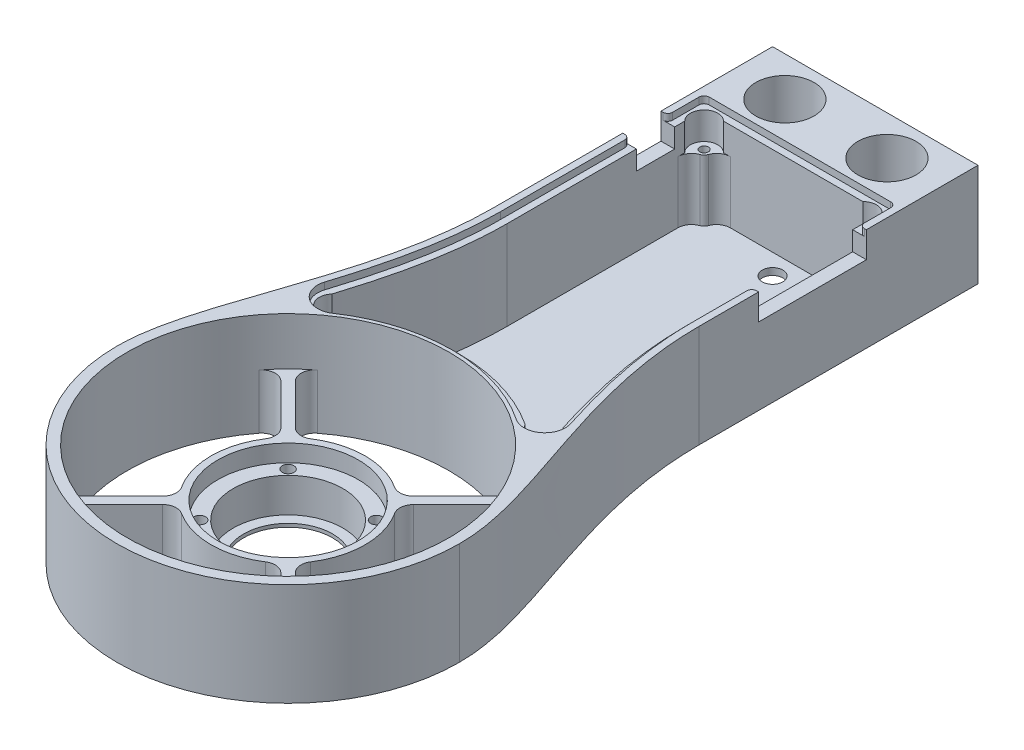
from build123d import *
from build123d.topology import SkipClean

# Parameters (mm, degrees)
EXTRUDE_1_DEPTH            = 30
CUT_EXTRUDE_1_DEPTH        = 209.327033807
SKETCH_3_R                 = 22.5
SKETCH_3_R_2               = 13
EXTRUDE_2_DEPTH            = 16
SKETCH_4_R                 = 20.5
CUT_EXTRUDE_2_DEPTH        = 5
SKETCH_5_R                 = 16
CUT_EXTRUDE_3_DEPTH        = 10
SKETCH_7_W                 = 1.7
SKETCH_7_H                 = 11
HOLE_WIZARD_M31_AT_2_COUNT = 2
HOLE_WIZARD_M31_AT_2_PITCH = 25.809397513
HOLE_WIZARD_M31_AT_3_COUNT = 2
HOLE_WIZARD_M31_AT_3_PITCH = 36.5
HOLE_WIZARD_M31_AT_4_COUNT = 2
HOLE_WIZARD_M31_AT_4_PITCH = 25.809397513
EXTRUDE_3_DEPTH            = 16
EXTRUDE_4_DEPTH            = 16
FILLET_1_R                 = 4
FILLET_2_R                 = 4
EXTRUDE_5_DEPTH            = 30
EXTRUDE_6_DEPTH            = 14
EXTRUDE_START              = -30
EXTRUDE_7_DEPTH            = 30
CUT_EXTRUDE_4_DEPTH        = 209.327033807
EXTRUDE_9_DEPTH            = 30
EXTRUDE_10_DEPTH           = 2
SKETCH_19_R                = 2.5
EXTRUDE_11_DEPTH           = 6
M3X0_51_D                  = 2.5
M3X0_51_DEPTH              = 5
M3X0_51_TIP                = 0.751075774
EXTRUDE_12_DEPTH           = 2
CUT_EXTRUDE_5_DEPTH        = 209.327033807
SKETCH_24_W                = 52
SKETCH_24_H                = 1.5
EXTRUDE_14_DEPTH           = 28
EXTRUDE_15_DEPTH           = 20
CUT_EXTRUDE_6_DEPTH        = 2
CUT_EXTRUDE_7_DEPTH        = 4
SKETCH_34_R                = 3
CUT_EXTRUDE_8_DEPTH        = 209.048439106
CUT_EXTRUDE_9_DEPTH        = 6
SKETCH_36_R                = 3
EXTRUDE_17_DEPTH           = 18
M3X0_52_D                  = 2.5
M3X0_52_DEPTH              = 8.5
M3X0_52_TIP                = 0.751075774
FILLET_4_R                 = 4
FILLET_START               = 1
FILLET_5_DEPTH             = 19
FILLET_6_R                 = 4
FILLET_7_DEPTH             = 19
FILLET_8_R                 = 4
SKETCH_39_R                = 3
CUT_EXTRUDE_10_DEPTH       = 209.048439106
CUT_EXTRUDE_12_DEPTH       = 2
FILLET_9_R                 = 1.5
CUT_EXTRUDE_13_REACH       = 210.327
SKETCH_44_W                = 11.16
SKETCH_44_H                = 7.6
FILLET_10_R                = 1.4
SKETCH_46_R                = 4
CUT_EXTRUDE_14_DEPTH       = 8
EXTRUDE_18_DEPTH           = 30


with BuildPart() as part:
    # Эскиз1 → Бобышка-Вытянуть1 (new body)
    with BuildSketch(Plane(origin=(0, 0, 0), x_dir=(1, 0, 0), z_dir=(0, 1, 0))):
        with BuildLine():
            Line((0, 0), (8.1, 0))
            ThreePointArc((8.1, 0), (15.1, -7), (22.1, 0))
            Line((22.1, 0), (37.9, 0))
            ThreePointArc((37.9, 0), (44.9, -7), (51.9, 0))
            Line((51.9, 0), (60, 0))
            Line((60, 0), (60, -50))
            add(Edge.make_bspline(
                [(60, -50), (60, -86.116353651), (80.160728995, -116.642608399), (80, -140)],
                knots=[0, 0, 0, 0, 1, 1, 1, 1], degree=3))
            ThreePointArc((80, -140), (30, -190), (-20, -140))
            add(Edge.make_bspline(
                [(0, -50), (0, -86.116353651), (-20.160728995, -116.642608399), (-20, -140)],
                knots=[0, 0, 0, 0, 1, 1, 1, 1], degree=3))
            Line((0, -50), (0, 0))
        make_face()
    extrude(amount=EXTRUDE_1_DEPTH)

    # Эскиз2 → Вырез-Вытянуть1 (cut, through all)
    with BuildSketch(Plane.XZ):
        with BuildLine():
            Line((3, 50), (3, 3))
            Line((3, 3), (5.560607986, 3))
            ThreePointArc((5.560607986, 3), (15.1, 10), (24.639392014, 3))
            Line((24.639392014, 3), (35.360607986, 3))
            ThreePointArc((35.360607986, 3), (44.9, 10), (54.439392014, 3))
            Line((54.439392014, 3), (57, 3))
            Line((57, 3), (57, 50))
            add(Edge.make_bspline(
                [(57, 50), (57, 51.157619484), (57.040607312, 53.481441414), (57.273709046, 58.05633088), (57.830062064, 63.685752057), (58.858254923, 70.27885976), (60.625878255, 78.854729592), (63.422502325, 89.162823296), (67.223452697, 100.856761308), (70.982787265, 111.851189123), (73.680425705, 120.399524986), (75.344386592, 126.838965256), (76.290218779, 131.460253347), (76.783421903, 135.123225854), (76.977758529, 137.948366969), (77.004903817, 139.304391304), (76.999998858, 139.989637546)],
                knots=[0, 0, 0, 0, 0.031254955, 0.062509911, 0.125019821, 0.187529732, 0.250039643, 0.375059464, 0.500079285, 0.625099107, 0.750118928, 0.812628839, 0.875138749, 0.93764866, 0.968903615, 1.000158571, 1.000158571, 1.000158571, 1.000158571], degree=3))
            ThreePointArc((76.999998858, 139.989637546), (30, 187), (-16.999998858, 139.989637546))
            add(Edge.make_bspline(
                [(-16.999998858, 139.989637546), (-17.004903817, 139.304391304), (-16.977758529, 137.948366969), (-16.783421903, 135.123225854), (-16.29021878, 131.460253347), (-15.344386592, 126.838965256), (-13.680425705, 120.399524986), (-10.982787266, 111.851189124), (-7.223452697, 100.856761308), (-3.422502325, 89.162823296), (-0.625878255, 78.854729592), (1.141745077, 70.27885976), (2.169937936, 63.685752057), (2.726290954, 58.05633088), (2.959392688, 53.481441414), (3, 51.157619484), (3, 50)],
                knots=[-0.000158571, -0.000158571, -0.000158571, -0.000158571, 0.031096385, 0.06235134, 0.124861251, 0.187371161, 0.249881072, 0.374900893, 0.499920715, 0.624940536, 0.749960357, 0.812470268, 0.874980179, 0.937490089, 0.968745045, 1, 1, 1, 1], degree=3))
        make_face()
    extrude(amount=-CUT_EXTRUDE_1_DEPTH, mode=Mode.SUBTRACT)

    # Эскиз9 → Бобышка-Вытянуть3 (add)
    with SkipClean():  # the faces are left unmerged after this step: merging them gives an invalid solid
        with BuildSketch(Plane.XZ):
            with BuildLine():
                ThreePointArc((-10.590299411, 110.803636994), (30, 89.99999981), (70.590299411, 110.803636994))
                add(Edge.make_bspline(
                    [(70.590299411, 110.803636994), (70.692739705, 111.112829984), (71.968212028, 114.973824728), (73.680425705, 120.399524986), (75.344386592, 126.838965256), (76.290218779, 131.460253347), (76.783421903, 135.123225854), (76.977758529, 137.948366969), (77.004903817, 139.304391304), (76.999998858, 139.989637546)],
                    knots=[0.614251023, 0.614251023, 0.614251023, 0.614251023, 0.625099107, 0.750118928, 0.812628839, 0.875138749, 0.93764866, 0.968903615, 1.000158571, 1.000158571, 1.000158571, 1.000158571], degree=3))
                ThreePointArc((76.999998858, 139.989637546), (30, 93), (-16.999998858, 139.989637546))
                add(Edge.make_bspline(
                    [(-16.999998858, 139.989637546), (-17.004903817, 139.304391304), (-16.977758529, 137.948366969), (-16.783421903, 135.123225854), (-16.29021878, 131.460253347), (-15.344386592, 126.838965256), (-13.680425705, 120.399524986), (-11.968212028, 114.973824728), (-10.692739705, 111.112829984), (-10.590299411, 110.803636994)],
                    knots=[-0.000158571, -0.000158571, -0.000158571, -0.000158571, 0.031096385, 0.06235134, 0.124861251, 0.187371161, 0.249881072, 0.374900893, 0.385748977, 0.385748977, 0.385748977, 0.385748977], degree=3))
            make_face()
        extrude(amount=-EXTRUDE_3_DEPTH)



with BuildPart() as body_2:
    # Эскиз3 → Бобышка-Вытянуть2 (new body)
    with BuildSketch(Plane.XZ):
        with Locations(Location((30, 140, 0), (0, 0, 270))):
            Circle(SKETCH_3_R)
        with Locations(Location((30, 140, 0), (0, 0, 270))):
            Circle(SKETCH_3_R_2, mode=Mode.SUBTRACT)
    extrude(amount=-EXTRUDE_2_DEPTH)

    # Эскиз4 → Вырез-Вытянуть2 (cut)
    with BuildSketch(Plane(origin=(0, 16, 0), x_dir=(1, 0, 0), z_dir=(0, 1, 0))):
        with Locations(Location((30, -140, 0), (0, 0, 270))):
            Circle(SKETCH_4_R)
    extrude(amount=-CUT_EXTRUDE_2_DEPTH, mode=Mode.SUBTRACT)

    # Эскиз5 → Вырез-Вытянуть3 (cut)
    with BuildSketch(Plane(origin=(0, 11, 0), x_dir=(1, 0, 0), z_dir=(0, 1, 0))):
        with Locations(Location((30, -140, 0), (0, 0, 270))):
            Circle(SKETCH_5_R)
    extrude(amount=-CUT_EXTRUDE_3_DEPTH, mode=Mode.SUBTRACT)

    # Эскиз7 → Отверстие с зазором M31 (revolve, cut)
    with BuildSketch(Plane(origin=(17.095301243, 11, 127.095301243), x_dir=(0, 0, 1), z_dir=(1, 0, 0))):
        with Locations((0.85, 5.5)):
            Rectangle(SKETCH_7_W, SKETCH_7_H)
    hole_wizard_m31 = revolve(axis=Axis((17.095301243, 17.35, 127.095301243), (0, -1, 0)), mode=Mode.SUBTRACT)

    # Отверстие с зазором M31 at 2: Отверстие с зазором M31 ×2
    with Locations(*[(i * HOLE_WIZARD_M31_AT_2_PITCH, 0, 0) for i in range(1, HOLE_WIZARD_M31_AT_2_COUNT)]):
        add(hole_wizard_m31, mode=Mode.SUBTRACT)

    # Отверстие с зазором M31 at 3: Отверстие с зазором M31 ×2
    with Locations(*[Vector(0.7071067811865477, 0, 0.7071067811865475) * (i * HOLE_WIZARD_M31_AT_3_PITCH) for i in range(1, HOLE_WIZARD_M31_AT_3_COUNT)]):
        add(hole_wizard_m31, mode=Mode.SUBTRACT)

    # Отверстие с зазором M31 at 4: Отверстие с зазором M31 ×2
    with Locations(*[(0, 0, i * HOLE_WIZARD_M31_AT_4_PITCH) for i in range(1, HOLE_WIZARD_M31_AT_4_COUNT)]):
        add(hole_wizard_m31, mode=Mode.SUBTRACT)


with BuildPart() as part_1:
    with SkipClean():  # the faces are left unmerged after this step: merging them gives an invalid solid
        add(part.part)

        add(body_2.part)  # Бобышка-Вытянуть4 merges body 2
        # Эскиз10 → Бобышка-Вытянуть4 (add)
        with BuildSketch(Plane.XZ):
            with BuildLine():
                Line((13.06156625, 154.810113507), (-4.284838091, 172.148870541))
                ThreePointArc((-4.284838091, 172.148870541), (-3.241274471, 173.226761376), (-2.163839457, 174.270795605))
                Line((-2.163839457, 174.270795605), (15.182490994, 156.931964648))
                ThreePointArc((15.182490994, 156.931964648), (14.086623923, 155.906428318), (13.06156625, 154.810113507))
            make_face()
            with BuildLine():
                Line((15.189886493, 123.06156625), (-2.148870541, 105.715161909))
                ThreePointArc((-2.148870541, 105.715161909), (-3.226761376, 106.758725529), (-4.270795605, 107.836160543))
                Line((-4.270795605, 107.836160543), (13.068035352, 125.182490994))
                ThreePointArc((13.068035352, 125.182490994), (14.093571682, 124.086623923), (15.189886493, 123.06156625))
            make_face()
            with BuildLine():
                Line((44.810113507, 156.93843375), (62.148870541, 174.284838091))
                ThreePointArc((62.148870541, 174.284838091), (63.226761376, 173.241274471), (64.270795605, 172.163839457))
                Line((64.270795605, 172.163839457), (46.931964648, 154.817509006))
                ThreePointArc((46.931964648, 154.817509006), (45.906428318, 155.913376077), (44.810113507, 156.93843375))
            make_face()
            with BuildLine():
                Line((46.93843375, 125.189886493), (64.284838091, 107.851129459))
                ThreePointArc((64.284838091, 107.851129459), (63.241274471, 106.773238624), (62.163839457, 105.729204395))
                Line((62.163839457, 105.729204395), (44.817509006, 123.068035352))
                ThreePointArc((44.817509006, 123.068035352), (45.913376077, 124.093571682), (46.93843375, 125.189886493))
            make_face()
        extrude(amount=-EXTRUDE_4_DEPTH)

    # Скругление1
    fillet_1_edges = [part_1.edges().sort_by_distance(p)[0] for p in [
        (70.590299411, 8, 110.803636994),
        (-10.590299411, 8, 110.803636994),
    ]]
    fillet(fillet_1_edges, radius=FILLET_1_R)

    # Скругление2
    fillet_2_edges = [part_1.edges().sort_by_distance(p)[0] for p in [
        (13.068035352, 8, 125.182490994),
        (-4.270795605, 8, 107.836160543),
        (13.06156625, 8, 154.810113507),
        (-4.284838091, 8, 172.148870541),
        (-2.163839457, 8, 174.270795605),
        (15.182490994, 8, 156.931964648),
        (44.810113507, 8, 156.93843375),
        (62.148870541, 8, 174.284838091),
        (46.931964648, 8, 154.817509006),
        (64.270795605, 8, 172.163839457),
        (46.93843375, 8, 125.189886493),
        (64.284838091, 8, 107.851129459),
        (44.817509006, 8, 123.068035352),
        (15.189886493, 8, 123.06156625),
        (-2.148870541, 8, 105.715161909),
        (62.163839457, 8, 105.729204395),
    ]]
    fillet(fillet_2_edges, radius=FILLET_2_R)

    # Эскиз11 → Бобышка-Вытянуть5 (add, through all)
    with BuildSketch(Plane(origin=(0, 30, 0), x_dir=(1, 0, 0), z_dir=(0, 1, 0))):
        with BuildLine():
            ThreePointArc((24.639392014, -3), (21.016079756, -8.062257768), (15.099999933, -10))
            Line((15.099999933, -10), (44.900000016, -10))
            ThreePointArc((44.900000016, -10), (38.983920224, -8.062257753), (35.360607986, -3))
            Line((35.360607986, -3), (24.639392014, -3))
        make_face()
        with BuildLine():
            ThreePointArc((54.439392014, -3), (50.81607979, -8.062257743), (44.900000016, -10))
            Line((44.900000016, -10), (57, -10))
            Line((57, -10), (57, -3))
            Line((57, -3), (54.439392014, -3))
        make_face()
        with BuildLine():
            Line((3, -3), (3, -10))
            Line((3, -10), (15.099999933, -10))
            ThreePointArc((15.099999933, -10), (9.18392019, -8.062257728), (5.560607986, -3))
            Line((5.560607986, -3), (3, -3))
        make_face()
    extrude(amount=-EXTRUDE_5_DEPTH)

    # Эскиз12 → Бобышка-Вытянуть6 (add)
    with SkipClean():  # the faces are left unmerged after this step: merging them gives an invalid solid
        with BuildSketch(Plane(origin=(0, 16, 0), x_dir=(1, 0, 0), z_dir=(0, 1, 0))):
            with BuildLine():
                ThreePointArc((59.169351437, -99.390284958), (30, -89.99999981), (0.830648563, -99.390284958))
                ThreePointArc((0.830648563, -99.390284958), (-3.85522263, -99.376716586), (-5.312887214, -94.923314864))
                add(Edge.make_bspline(
                    [(-5.312887214, -94.923314864), (-5.94223774, -96.891654802), (-7.843811242, -102.671041765), (-10.982787266, -111.851189124), (-13.680425705, -120.399524986), (-15.344386592, -126.838965256), (-16.29021878, -131.460253347), (-16.783421903, -135.123225854), (-16.977758529, -137.948366969), (-17.004903817, -139.304391304), (-16.999998858, -139.989637546)],
                    knots=[-0.000158571, -0.000158571, -0.000158571, -0.000158571, 0.062969621, 0.187989442, 0.313009264, 0.375519174, 0.438029085, 0.500538996, 0.531793951, 0.563048906, 0.563048906, 0.563048906, 0.563048906], degree=3))
                ThreePointArc((-16.999998858, -139.989637546), (30, -93), (76.999998858, -139.989637546))
                add(Edge.make_bspline(
                    [(76.999998858, -139.989637546), (77.004903817, -139.304391304), (76.977758529, -137.948366969), (76.783421903, -135.123225854), (76.290218779, -131.460253347), (75.344386592, -126.838965256), (73.680425705, -120.399524986), (70.982787265, -111.851189123), (67.843811241, -102.671041765), (65.94223774, -96.891654802), (65.312887214, -94.923314864)],
                    knots=[0.436951094, 0.436951094, 0.436951094, 0.436951094, 0.468206049, 0.499461004, 0.561970915, 0.624480826, 0.686990736, 0.812010558, 0.937030379, 1.000158571, 1.000158571, 1.000158571, 1.000158571], degree=3))
                ThreePointArc((65.312887214, -94.923314864), (63.85522263, -99.376716586), (59.169351437, -99.390284958))
            make_face()
        extrude(amount=EXTRUDE_6_DEPTH)
    add(part_1.part.scale(1), mode=Mode.REPLACE)  # the faces are merged on a copy

    # Эскиз13 → Бобышка-Вытянуть7 (add)
    with BuildSketch(Plane(origin=(0, 30, 0), x_dir=(1, 0, 0), z_dir=(0, 1, 0)).offset(EXTRUDE_START)):
        with BuildLine():
            Line((4, -50), (4, -11))
            Line((4, -11), (56, -11))
            Line((56, -11), (56, -50))
            add(Edge.make_bspline(
                [(56, -50), (56, -52.034980681), (56.125270586, -56.131935358), (56.819212399, -64.088500397), (58.410810449, -73.747778237), (60.678363501, -82.951847558), (62.737499644, -90.067621054), (63.80856927, -93.502002348), (64.360390296, -95.22786309)],
                knots=[0, 0, 0, 0, 0.054618887, 0.109237773, 0.218475547, 0.32771332, 0.382332207, 0.436951094, 0.436951094, 0.436951094, 0.436951094], degree=3))
            Line((64.360390296, -95.22786309), (65.166149164, -97.747933059))
            ThreePointArc((65.166149164, -97.747933059), (65.497512903, -96.349026708), (65.312887214, -94.923314864))
            add(Edge.make_bspline(
                [(57, -50), (57, -51.157619484), (57.040607312, -53.481441414), (57.273709046, -58.05633088), (57.830062064, -63.685752057), (58.858254923, -70.27885976), (60.625878255, -78.854729592), (62.85764527, -87.080813237), (64.695864475, -92.993530982), (65.312887214, -94.923314864)],
                knots=[0, 0, 0, 0, 0.031254955, 0.062509911, 0.125019821, 0.187529732, 0.250039643, 0.375059464, 0.436951094, 0.436951094, 0.436951094, 0.436951094], degree=3))
            Line((57, -50), (57, -10))
            Line((57, -10), (3, -10))
            Line((3, -10), (3, -50))
            add(Edge.make_bspline(
                [(-5.312887214, -94.923314864), (-4.695864475, -92.993530982), (-2.85764527, -87.080813237), (-0.625878255, -78.854729592), (1.141745077, -70.27885976), (2.169937936, -63.685752057), (2.726290954, -58.05633088), (2.959392688, -53.481441414), (3, -51.157619484), (3, -50)],
                knots=[0.563048906, 0.563048906, 0.563048906, 0.563048906, 0.624940536, 0.749960357, 0.812470268, 0.874980179, 0.937490089, 0.968745045, 1, 1, 1, 1], degree=3))
            ThreePointArc((-5.312887214, -94.923314864), (-5.497512903, -96.349026708), (-5.166149164, -97.747933059))
            Line((-5.166149164, -97.747933059), (-4.360390296, -95.22786309))
            add(Edge.make_bspline(
                [(-4.360390296, -95.22786309), (-3.80856927, -93.502002348), (-2.737499644, -90.067621054), (-0.678363501, -82.951847558), (1.589189551, -73.747778237), (3.180787601, -64.088500397), (3.874729414, -56.131935358), (4, -52.034980681), (4, -50)],
                knots=[0.563048906, 0.563048906, 0.563048906, 0.563048906, 0.617667793, 0.67228668, 0.781524453, 0.890762227, 0.945381113, 1, 1, 1, 1], degree=3))
        make_face()
    extrude(amount=EXTRUDE_7_DEPTH)

    # Эскиз14 → Вырез-Вытянуть4 (cut, through all)
    with BuildSketch(Plane(origin=(0, 30, 0), x_dir=(1, 0, 0), z_dir=(0, 1, 0))):
        with BuildLine():
            Line((4, -50), (56, -50))
            add(Edge.make_bspline(
                [(56, -50), (56, -52.034980681), (56.125270586, -56.131935358), (56.819212399, -64.088500397), (58.410810449, -73.747778237), (60.678363501, -82.951847558), (62.737499644, -90.067621054), (63.80856927, -93.502002348), (64.360390296, -95.22786309)],
                knots=[0, 0, 0, 0, 0.054618887, 0.109237773, 0.218475547, 0.32771332, 0.382332207, 0.436951094, 0.436951094, 0.436951094, 0.436951094], degree=3))
            Line((64.360390296, -95.22786309), (68.459948644, -108.049532565))
            ThreePointArc((68.459948644, -108.049532565), (30, -89.99999981), (-8.459948644, -108.049532565))
            Line((-8.459948644, -108.049532565), (-4.360390296, -95.22786309))
            add(Edge.make_bspline(
                [(-4.360390296, -95.22786309), (-3.80856927, -93.502002348), (-2.737499644, -90.067621054), (-0.678363501, -82.951847558), (1.589189551, -73.747778237), (3.180787601, -64.088500397), (3.874729414, -56.131935358), (4, -52.034980681), (4, -50)],
                knots=[0.563048906, 0.563048906, 0.563048906, 0.563048906, 0.617667793, 0.67228668, 0.781524453, 0.890762227, 0.945381113, 1, 1, 1, 1], degree=3))
        make_face()
    extrude(amount=-CUT_EXTRUDE_4_DEPTH, mode=Mode.SUBTRACT)

    # Эскиз15 → Бобышка-Вытянуть9 (add)
    with BuildSketch(Plane(origin=(0, 30, 0), x_dir=(1, 0, 0), z_dir=(0, 1, 0))):
        with BuildLine():
            Line((-4.360390296, -95.22786309), (-8.459948644, -108.049532565))
            ThreePointArc((-8.459948644, -108.049532565), (-3.531205401, -102.910132335), (2.077630415, -98.523002811))
            ThreePointArc((2.077630415, -98.523002811), (-2.535344593, -98.420348423), (-3.982504348, -94.039046676))
            add(Edge.make_bspline(
                [(-4.360390296, -95.22786309), (-4.233592317, -94.831293107), (-4.107654238, -94.435180898), (-3.982504348, -94.039046676)],
                knots=[0.563048906, 0.563048906, 0.563048906, 0.563048906, 0.575599288, 0.575599288, 0.575599288, 0.575599288], degree=3))
        make_face()
        with BuildLine():
            Line((68.459948644, -108.049532565), (64.360390296, -95.22786309))
            add(Edge.make_bspline(
                [(63.982538134, -94.03915362), (64.107676904, -94.43525219), (64.233603727, -94.831328794), (64.360390296, -95.22786309)],
                knots=[0.424401841, 0.424401841, 0.424401841, 0.424401841, 0.436951094, 0.436951094, 0.436951094, 0.436951094], degree=3))
            ThreePointArc((63.982538134, -94.03915362), (62.53530146, -98.420382479), (57.922370807, -98.523003634))
            ThreePointArc((57.922370807, -98.523003634), (63.531205947, -102.910132829), (68.459948644, -108.049532565))
        make_face()
    extrude(amount=-EXTRUDE_9_DEPTH)

    # Эскиз16 → Бобышка-Вытянуть10 (add)
    with BuildSketch(Plane.XZ):
        Polygon((-7.852464766, 101.935174027), (-2.068237999, 81.427460947), (2.401391775, 58.816392678), (2.401391775, 39.097437793), (2.401391775, 22.533515689), (2.401391775, 9.387545766), (57.351546055, 9.387545766), (57.351546055, 36.731163207), (57.351546055, 56.975956889), (62.609934024, 81.427460947), (67.020194902, 101.935174027), (62.609934024, 101.935174027), (57.351546055, 100.895725243), (53.104612881, 97.852307048), (47.493444526, 95.406397044), (40.928616834, 92.544786642), (34.931301468, 92.544786642), (28.840892836, 91.340868656), (21.733587887, 92.869321333), (13.415834781, 94.658085442), (5.092688812, 97.852307048), (-1.046943422, 101.935174027), align=None)
    extrude(amount=-EXTRUDE_10_DEPTH)

    # Эскиз19 → Бобышка-Вытянуть11 (add)
    with BuildSketch(Plane(origin=(0, 2, 0), x_dir=(1, 0, 0), z_dir=(0, 1, 0))):
        with Locations(Location((7.5, -18.5, 0), (0, 0, 90))):
            Circle(SKETCH_19_R)
        with Locations(Location((52.5, -18.5, 0), (0, 0, 90))):
            Circle(SKETCH_19_R)
        with Locations(Location((52.5, -63.5, 0), (0, 0, 90))):
            Circle(SKETCH_19_R)
        with Locations(Location((7.5, -63.5, 0), (0, 0, 90))):
            Circle(SKETCH_19_R)
    extrude(amount=EXTRUDE_11_DEPTH)

    # Отверстие обработанное метчиком M3x0.51
    with Locations(Plane(origin=(0, 8, 0), x_dir=(1, 0, 0), z_dir=(0, 1, 0))):
        with Locations((7.5, -18.5), (52.5, -18.5), (52.5, -63.5), (7.5, -63.5)):
            Hole(M3X0_51_D / 2, depth=M3X0_51_DEPTH)
            with Locations((0, 0, -(M3X0_51_DEPTH + M3X0_51_TIP / 2))):  # 118° drill point
                Cone(0, M3X0_51_D / 2, M3X0_51_TIP, mode=Mode.SUBTRACT)

    # Эскиз22 → Бобышка-Вытянуть12 (add)
    with BuildSketch(Plane(origin=(0, 2, 0), x_dir=(1, 0, 0), z_dir=(0, 1, 0))):
        with BuildLine():
            ThreePointArc((9.974873734, -18.853553391), (9.267766953, -20.267766953), (7.853553391, -20.974873734))
            Line((7.853553391, -20.974873734), (27.878679656, -41))
            Line((27.878679656, -41), (7.853553391, -61.025126266))
            ThreePointArc((7.853553391, -61.025126266), (9.267766953, -61.732233047), (9.974873734, -63.146446609))
            Line((9.974873734, -63.146446609), (30, -43.121320344))
            Line((30, -43.121320344), (50.025126266, -63.146446609))
            ThreePointArc((50.025126266, -63.146446609), (50.732233047, -61.732233047), (52.146446609, -61.025126266))
            Line((52.146446609, -61.025126266), (32.121320344, -41))
            Line((32.121320344, -41), (52.146446609, -20.974873734))
            ThreePointArc((52.146446609, -20.974873734), (50.732233047, -20.267766953), (50.025126266, -18.853553391))
            Line((50.025126266, -18.853553391), (30, -38.878679656))
            Line((30, -38.878679656), (9.974873734, -18.853553391))
        make_face()
        with BuildLine():
            Line((4, -20), (5.5, -20))
            ThreePointArc((5.5, -20), (5, -18.5), (5.5, -17))
            Line((5.5, -17), (4, -17))
            Line((4, -17), (4, -20))
        make_face()
        with BuildLine():
            ThreePointArc((5.5, -65), (5, -63.5), (5.5, -62))
            Line((5.5, -62), (3.315002208, -62))
            add(Edge.make_bspline(
                [(2.940902429, -65), (3.073908034, -64.031610352), (3.199237612, -63.031667865), (3.31200872, -62.026758174), (3.315002208, -62)],
                knots=[0.863646764, 0.863646764, 0.863646764, 0.863646764, 0.890762227, 0.891503892, 0.891503892, 0.891503892, 0.891503892], degree=3))
            Line((2.940902429, -65), (5.5, -65))
        make_face()
        with BuildLine():
            Line((56, -17), (54.5, -17))
            ThreePointArc((54.5, -17), (55, -18.5), (54.5, -20))
            Line((54.5, -20), (56, -20))
            Line((56, -20), (56, -17))
        make_face()
        with BuildLine():
            ThreePointArc((54.5, -62), (55, -63.5), (54.5, -65))
            Line((54.5, -65), (57.059097571, -65))
            add(Edge.make_bspline(
                [(56.684997792, -62), (56.68799128, -62.026758174), (56.800762388, -63.031667865), (56.926091965, -64.031610352), (57.059097571, -65)],
                knots=[0.108496108, 0.108496108, 0.108496108, 0.108496108, 0.109237773, 0.136353236, 0.136353236, 0.136353236, 0.136353236], degree=3))
            Line((56.684997792, -62), (54.5, -62))
        make_face()
    extrude(amount=EXTRUDE_12_DEPTH)

    # Эскиз23 → Вырез-Вытянуть5 (cut, through all)
    with BuildSketch(Plane(origin=(0, 30, 0), x_dir=(1, 0, 0), z_dir=(0, 1, 0))):
        with BuildLine():
            Line((8.1, 0), (6.6, 0))
            ThreePointArc((6.6, 0), (15.1, -8.5), (23.6, 0))
            Line((23.6, 0), (22.1, 0))
            ThreePointArc((22.1, 0), (15.1, -7), (8.1, 0))
        make_face()
        with BuildLine():
            Line((53.4, 0), (51.9, 0))
            ThreePointArc((51.9, 0), (44.9, -7), (37.9, 0))
            Line((37.9, 0), (36.4, 0))
            ThreePointArc((36.4, 0), (44.9, -8.5), (53.4, 0))
        make_face()
    extrude(amount=-CUT_EXTRUDE_5_DEPTH, mode=Mode.SUBTRACT)

    # Эскиз24 → Бобышка-Вытянуть14 (add)
    with BuildSketch(Plane(origin=(0, 2, 0), x_dir=(1, 0, 0), z_dir=(0, 1, 0))):
        with Locations((30, -11.75)):
            Rectangle(SKETCH_24_W, SKETCH_24_H)
    extrude(amount=EXTRUDE_14_DEPTH)


with BuildPart() as body_2_2:
    # Split Bodies 1: read off the stored shape, not the designer's step
    # Split Bodies 1: the piece on the far side of the plane
    add(part_1.part)
    split(bisect_by=Plane.XY.offset(41.123183465), keep=Keep.BOTTOM)


with BuildPart() as part_2:
    add(part_1.part)

    # Split Bodies 1
    split(bisect_by=Plane.XY.offset(41.123183465), keep=Keep.TOP)



with BuildPart() as body_2_2_1:
    # Move Body 1: read off the stored shape, not the designer's step
    # Move Body 1: moved
    add(body_2_2.part.moved(Location((0, 0, -20))))


with BuildPart() as part_3:
    add(part_2.part)

    add(body_2_2_1.part)  # Бобышка-Вытянуть15 merges body 2 2
    # Эскиз27 → Бобышка-Вытянуть15 (add)
    with BuildSketch(Plane(origin=(0, 0, 41.123183465), x_dir=(-1, 0, 0), z_dir=(0, 0, -1))):
        Polygon((-60, 0), (0, 0), (0, 30), (-4, 30), (-4, 2), (-56, 2), (-56, 30), (-60, 30), align=None)
    extrude(amount=EXTRUDE_15_DEPTH)

    # Эскиз31 → Вырез-Вытянуть6 (cut)
    with BuildSketch(Plane(origin=(0, 30, 0), x_dir=(1, 0, 0), z_dir=(0, 1, 0))):
        with BuildLine():
            Line((58, -50), (58, 9.5))
            Line((58, 9.5), (2, 9.5))
            Line((2, 9.5), (2, -50))
            add(Edge.make_bspline(
                [(2, -50), (2, -53.699300475), (1.793050573, -57.386405136), (1.211129131, -62.901062421), (0.97232817, -64.735113189), (0.414928411, -68.387396341), (0.096175926, -70.206931321), (-0.612795733, -73.834212995), (-1.003172031, -75.642278607), (-1.844400633, -79.239733159), (-2.295455623, -81.030251086), (-3.724777276, -86.381266668), (-4.779021803, -89.921274352), (-5.892373376, -93.445341845)],
                knots=[0, 0, 0, 0, 0.25, 0.25, 0.375, 0.375, 0.5, 0.5, 0.625, 0.625, 0.75, 0.75, 1, 1, 1, 1], degree=3))
            ThreePointArc((-5.892373376, -93.445341845), (-3.729477768, -100.024738414), (3.194525369, -100.182082575))
            ThreePointArc((3.194525369, -100.182082575), (30.000000812, -91.99999981), (56.805475979, -100.182083482))
            ThreePointArc((56.805475979, -100.182083482), (63.729424876, -100.02477977), (65.892414554, -93.445472173))
            add(Edge.make_bspline(
                [(65.892414554, -93.445472173), (64.778275492, -89.918916093), (63.722933797, -86.375258803), (61.814584417, -79.229095389), (60.963396016, -75.630590785), (59.900229344, -70.187221308), (59.581220007, -68.364321505), (59.024766004, -64.71388467), (58.786982896, -62.884890165), (58.207211576, -57.385434994), (58, -53.702390763), (58, -50)],
                knots=[0, 0, 0, 0, 0.25, 0.25, 0.5, 0.5, 0.625, 0.625, 0.75, 0.75, 1, 1, 1, 1], degree=3))
        make_face()
    extrude(amount=-CUT_EXTRUDE_6_DEPTH, mode=Mode.SUBTRACT)

    # Эскиз33 → Вырез-Вытянуть7 (cut)
    with BuildSketch(Plane(origin=(60, 0, 0), x_dir=(0, 0, -1), z_dir=(1, 0, 0))):
        Polygon((-24.96, 30), (-32.58, 30), (-32.58, 25.44), (-32.58, 22.4), (-29.54, 22.4), (-24.96, 22.4), (-21.92, 22.4), (-19.38, 22.4), (-16.84, 22.4), (-14.3, 22.4), (-11.76, 22.4), (-9.22, 22.4), (-6.68, 22.4), (-4.14, 22.4), (-1.1, 22.4), (-1.1, 25.44), (-1.1, 30), align=None)
    extrude(amount=-CUT_EXTRUDE_7_DEPTH, mode=Mode.SUBTRACT)

    # Эскиз34 → Вырез-Вытянуть8 (cut, through all)
    with BuildSketch(Plane(origin=(0, 2, 0), x_dir=(1, 0, 0), z_dir=(0, 1, 0))):
        with Locations(Location((5.178106811, -89.227815171, 0), (0, 0, 270))):
            Circle(SKETCH_34_R)
        with Locations(Location((54.821893189, -89.227815171, 0), (0, 0, 90))):
            Circle(SKETCH_34_R)
    extrude(amount=-CUT_EXTRUDE_8_DEPTH, mode=Mode.SUBTRACT)

    # Эскиз35 → Вырез-Вытянуть9 (cut)
    with BuildSketch(Plane(origin=(0, 8, 0), x_dir=(1, 0, 0), z_dir=(0, 1, 0))):
        with BuildLine():
            Line((4, 7.5), (56, 7.5))
            Line((56, 7.5), (56, -50))
            add(Edge.make_bspline(
                [(57.382839337, -67.210838592), (57.119444295, -65.516112065), (56.624169486, -61.852186644), (56.125270586, -56.131935358), (56, -52.034980681), (56, -50)],
                knots=[0.267332174, 0.267332174, 0.267332174, 0.267332174, 0.315164068, 0.369782955, 0.424401841, 0.424401841, 0.424401841, 0.424401841], degree=3))
            Line((57.382839337, -67.210838592), (2.617160663, -67.210838592))
            add(Edge.make_bspline(
                [(4, -50), (4, -52.034980681), (3.874729414, -56.131935358), (3.375830514, -61.852186644), (2.880555705, -65.516112065), (2.617160663, -67.210838592)],
                knots=[0.575599288, 0.575599288, 0.575599288, 0.575599288, 0.630218175, 0.684837061, 0.732668956, 0.732668956, 0.732668956, 0.732668956], degree=3))
            Line((4, -50), (4, 7.5))
        make_face()
    extrude(amount=-CUT_EXTRUDE_9_DEPTH, mode=Mode.SUBTRACT)

    # Эскиз36 → Бобышка-Вытянуть17 (add)
    with BuildSketch(Plane(origin=(0, 2, 0), x_dir=(1, 0, 0), z_dir=(0, 1, 0))):
        with Locations((-0.811267397, -96.088490424)):
            Circle(SKETCH_36_R)
        with Locations((60.811267397, -96.088490424)):
            Circle(SKETCH_36_R)
        with BuildLine():
            Line((4, 7.5), (6, 7.5))
            ThreePointArc((6, 7.5), (7.414213562, 4.085786438), (4, 5.5))
            Line((4, 5.5), (4, 7.5))
        make_face()
        with BuildLine():
            Line((56, 7.5), (54, 7.5))
            ThreePointArc((54, 7.5), (52.585786438, 4.085786438), (56, 5.5))
            Line((56, 5.5), (56, 7.5))
        make_face()
    extrude(amount=EXTRUDE_17_DEPTH)

    # Отверстие обработанное метчиком M3x0.52
    with Locations(Plane(origin=(0, 20, 0), x_dir=(1, 0, 0), z_dir=(0, 1, 0))):
        with Locations((-0.811267397, -96.088490424), (60.811267397, -96.088490424), (54, 5.5), (6, 5.5)):
            Hole(M3X0_52_D / 2, depth=M3X0_52_DEPTH)
            with Locations((0, 0, -(M3X0_52_DEPTH + M3X0_52_TIP / 2))):  # 118° drill point
                Cone(0, M3X0_52_D / 2, M3X0_52_TIP, mode=Mode.SUBTRACT)

    # Скругление4
    # the kernel refuses this fillet: 4 mm, written as the material it adds along each edge
    with BuildSketch(Plane(origin=(61.221909136, 2, 99.060253094), x_dir=(-0.9225636556466345, 0, -0.38584491869132853), z_dir=(0, 1, 0))) as fillet_4_piece_1:
        with BuildLine():
            CenterArc((8.383622748, -3.98530699), FILLET_4_R, 85.087573596, 83.357833532)
            Line((4.46468556, -3.184100826), (4.072791842, -3.10398021))
            ThreePointArc((4.072791842, -3.10398021), (3.035144293, -0.466377415), (0.203397689, -0.34442616))
            Line((0.203397689, -0.34442616), (-0.247081102, 0.314564666))
            ThreePointArc((-0.247081102, 0.314564666), (3.329380927, 1.169774266), (8.760407993, 0.398530699))
            Line((8.760407993, 0.398530699), (8.726154789, 0))
        make_face()
    extrude(amount=18)

    # Скругление5: read off the stored shape, not the designer's step
    # Скругление5 outline → Скругление5 (add)
    with BuildSketch(Plane(origin=(0, 0, 0), x_dir=(1, 0, 0), z_dir=(0, 1, 0)).offset(FILLET_START)):
        with BuildLine():
            ThreePointArc((62.257648237, -88.384981), (61.988127997, -91.316026108), (59.786050251, -93.269105775))
            ThreePointArc((59.786050251, -93.269105775), (63.01921188, -94.05748546), (63.535405422, -97.34510175))
            ThreePointArc((63.535405422, -97.34510175), (64.12006922, -95.740966466), (63.982538134, -94.03915362))
            add(Edge.make_bspline(
                [(62.257648237, -88.384981), (62.419832764, -88.938389353), (62.98533962, -90.842963809), (63.563027697, -92.711287886), (63.982538134, -94.03915362)],
                knots=[0.36522033, 0.36522033, 0.36522033, 0.36522033, 0.382332207, 0.424401841, 0.424401841, 0.424401841, 0.424401841], degree=3))
        make_face()
    extrude(amount=FILLET_5_DEPTH)

    # Скругление6
    # the kernel refuses this fillet: 4 mm, written as the material it adds along each edge
    with BuildSketch(Plane(origin=(-1.221898724, -19.815364345, 99.060254532), x_dir=(0.9225634193110782, 0, -0.38584548377433653), z_dir=(0, 1, 0))) as fillet_6_piece_1_section:
        with BuildLine():
            CenterArc((8.383616139, 3.985307199), FILLET_6_R, 191.554557777, 83.357833532)
            Line((4.46467846, 3.184103436), (4.072784692, 3.10398306))
            ThreePointArc((4.072784692, 3.10398306), (3.035139236, 0.466383546), (0.203396693, 0.344426749))
            Line((0.203396693, 0.344426749), (-0.247080569, -0.314565084))
            ThreePointArc((-0.247080569, -0.314565084), (3.329372592, -1.169770675), (8.760398698, -0.39853072))
            Line((8.760398698, -0.39853072), (8.726145738, 0))
        make_face()
    fillet_6_piece_1 = extrude(amount=39.815364345, mode=Mode.PRIVATE)
    fillet_6_piece_1 = split(fillet_6_piece_1, bisect_by=Plane(origin=(-1.221898724, 0, 99.060254532), z_dir=(0, 1, 0)), keep=Keep.TOP, mode=Mode.PRIVATE)
    add(fillet_6_piece_1)

    # Скругление7: read off the stored shape, not the designer's step
    # Скругление7 outline → Скругление7 (add)
    with BuildSketch(Plane(origin=(0, 0, 0), x_dir=(1, 0, 0), z_dir=(0, 1, 0)).offset(FILLET_START)):
        with BuildLine():
            ThreePointArc((0.213949749, -93.269105775), (-1.988127997, -91.316026108), (-2.257648237, -88.384981))
            add(Edge.make_bspline(
                [(-3.982504348, -94.039046676), (-3.563005648, -92.711216577), (-2.985328828, -90.842927463), (-2.419832764, -88.938389353), (-2.257648237, -88.384981)],
                knots=[0.575599288, 0.575599288, 0.575599288, 0.575599288, 0.617667793, 0.63477967, 0.63477967, 0.63477967, 0.63477967], degree=3))
            ThreePointArc((-3.982504348, -94.039046676), (-4.12007604, -95.740903809), (-3.535411218, -97.345089184))
            ThreePointArc((-3.535411218, -97.345089184), (-3.019207195, -94.057480368), (0.213949749, -93.269105775))
        make_face()
    extrude(amount=FILLET_7_DEPTH)

    # Скругление8
    fillet_8_edges = [part_3.edges().sort_by_distance(p)[0] for p in [
        (4, 11, -5.5),
        (6, 11, -7.5),
        (54, 11, -7.5),
    ]]
    fillet(fillet_8_edges, radius=FILLET_8_R)
    fillet_8_2_edges = [part_3.edges().sort_by_distance(p)[0] for p in [
        (56, 11, -5.5),
    ]]
    fillet(fillet_8_2_edges, radius=FILLET_8_R)

    # Эскиз39 → Вырез-Вытянуть10 (cut, through all)
    with BuildSketch(Plane(origin=(0, 2, 0), x_dir=(1, 0, 0), z_dir=(0, 1, 0))):
        with Locations(Location((30, 1.5, 0), (0, 0, 270))):
            Circle(SKETCH_39_R)
    extrude(amount=-CUT_EXTRUDE_10_DEPTH, mode=Mode.SUBTRACT)

    # Эскиз42 → Вырез-Вытянуть12 (cut)
    with BuildSketch(Plane(origin=(0, 30, 0), x_dir=(1, 0, 0), z_dir=(0, 1, 0))):
        with BuildLine():
            Line((58, -1.1), (58, 0.3))
            ThreePointArc((58, 0.3), (58.410050506, -0.689949494), (59.4, -1.1))
            Line((59.4, -1.1), (58, -1.1))
        make_face()
        with BuildLine():
            Line((58, -32.58), (59.4, -32.58))
            ThreePointArc((59.4, -32.58), (58.410050506, -32.990050506), (58, -33.98))
            Line((58, -33.98), (58, -32.58))
        make_face()
    extrude(amount=-CUT_EXTRUDE_12_DEPTH, mode=Mode.SUBTRACT)

    # Скругление9
    fillet_9_edges = [part_3.edges().sort_by_distance(p)[0] for p in [
        (2, 29, -9.5),
        (58, 29, -9.5),
    ]]
    fillet(fillet_9_edges, radius=FILLET_9_R)

    # Вырез-Вытянуть13: up to this face of the body (flat: up to its plane)
    cut_extrude_13_end = Plane(part_3.part.faces().sort_by_distance((4, 15.406206161, 23.780824111))[0])
    # Эскиз44 → Вырез-Вытянуть13 (cut, up to the picked face)
    with BuildSketch(Plane.ZY, mode=Mode.PRIVATE) as cut_extrude_13_sk1:
        with Locations((6.68, 26.2)):
            Rectangle(SKETCH_44_W, SKETCH_44_H)
    cut_extrude_13_tool1 = split(extrude(cut_extrude_13_sk1.sketch, amount=-CUT_EXTRUDE_13_REACH, mode=Mode.PRIVATE), bisect_by=cut_extrude_13_end, keep=Keep.BOTH, mode=Mode.PRIVATE)
    add(cut_extrude_13_tool1.solids().sort_by(Axis((0, 26.2, 6.68), (1, 0, 0)))[0], mode=Mode.SUBTRACT)

    # Скругление10
    fillet_10_edges = [part_3.edges().sort_by_distance(p)[0] for p in [
        (2, 29, 12.26),
        (2, 29, 1.1),
    ]]
    fillet(fillet_10_edges, radius=FILLET_10_R)

    # Эскиз46 → Вырез-Вытянуть14 (cut)
    with BuildSketch(Plane(origin=(0, 28, 0), x_dir=(1, 0, 0), z_dir=(0, 1, 0))):
        with Locations((6.828427125, 4.671572875)):
            Circle(SKETCH_46_R)
        with Locations((53.171572875, 4.671572875)):
            Circle(SKETCH_46_R)
        with Locations((-0.811267397, -96.088490424)):
            Circle(SKETCH_46_R)
        with Locations((60.811267397, -96.088490424)):
            Circle(SKETCH_46_R)
    extrude(amount=-CUT_EXTRUDE_14_DEPTH, mode=Mode.SUBTRACT)

    # Эскиз48 → Бобышка-Вытянуть18 (add)
    with BuildSketch(Plane.XZ.offset(EXTRUDE_START)):
        with BuildLine():
            Line((60, -20), (53.4, -20))
            ThreePointArc((53.4, -20), (44.9, -28.5), (36.4, -20))
            Line((36.4, -20), (23.6, -20))
            ThreePointArc((23.6, -20), (15.1, -28.5), (6.6, -20))
            Line((6.6, -20), (0, -20))
            Line((0, -20), (0, -31.5))
            Line((0, -31.5), (60, -31.5))
            Line((60, -31.5), (60, -20))
        make_face()
    extrude(amount=EXTRUDE_18_DEPTH)


solid = part_3.part
